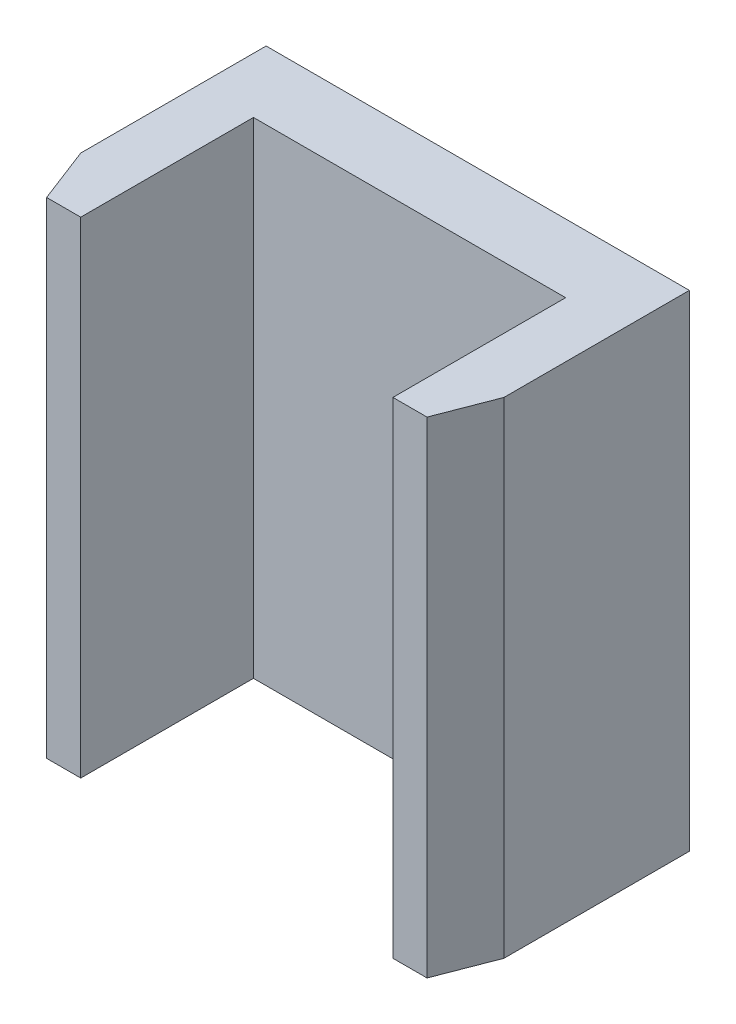
from build123d import *

# Parameters (mm, degrees)
SKETCH1_W           = 55.1
SKETCH1_H           = 111.1
BOSS_EXTRUDE1_DEPTH = 12.7
SKETCH2_W           = 15.6
SKETCH2_H           = 111.1
BOSS_EXTRUDE2_DEPTH = 71.4
SKETCH4_W           = 55.1
SKETCH4_H           = 111.1
BOSS_EXTRUDE3_DEPTH = 12.7
CUT_EXTRUDE2_DEPTH  = 150.840014682


with BuildPart() as part:
    # Sketch1 → Boss-Extrude1 (new body)
    with BuildSketch(Plane(origin=(0, 0, 0), x_dir=(0, 0, -1), z_dir=(1, 0, 0))):
        with Locations((27.55, 55.55)):
            Rectangle(SKETCH1_W, SKETCH1_H)
    extrude(amount=BOSS_EXTRUDE1_DEPTH)

    # Sketch2 → Boss-Extrude2 (add)
    with BuildSketch(Plane.ZY):
        with Locations((-47.3, 55.55)):
            Rectangle(SKETCH2_W, SKETCH2_H)
    extrude(amount=BOSS_EXTRUDE2_DEPTH)

    # Sketch4 → Boss-Extrude3 (add)
    with BuildSketch(Plane.ZY.offset(71.4)):
        with Locations((-27.55, 55.55)):
            Rectangle(SKETCH4_W, SKETCH4_H)
    extrude(amount=BOSS_EXTRUDE3_DEPTH)

    # Sketch5 → Cut-Extrude2 (cut, through all)
    with BuildSketch(Plane(origin=(0, 111.1, 0), x_dir=(1, 0, 0), z_dir=(0, 1, 0))):
        Polygon((12.7, 0), (12.7, 12.7), (7.8, 0), align=None)
        Polygon((-84.1, 0), (-84.1, 12.7), (-79.2, 0), align=None)
    extrude(amount=-CUT_EXTRUDE2_DEPTH, mode=Mode.SUBTRACT)


solid = part.part
